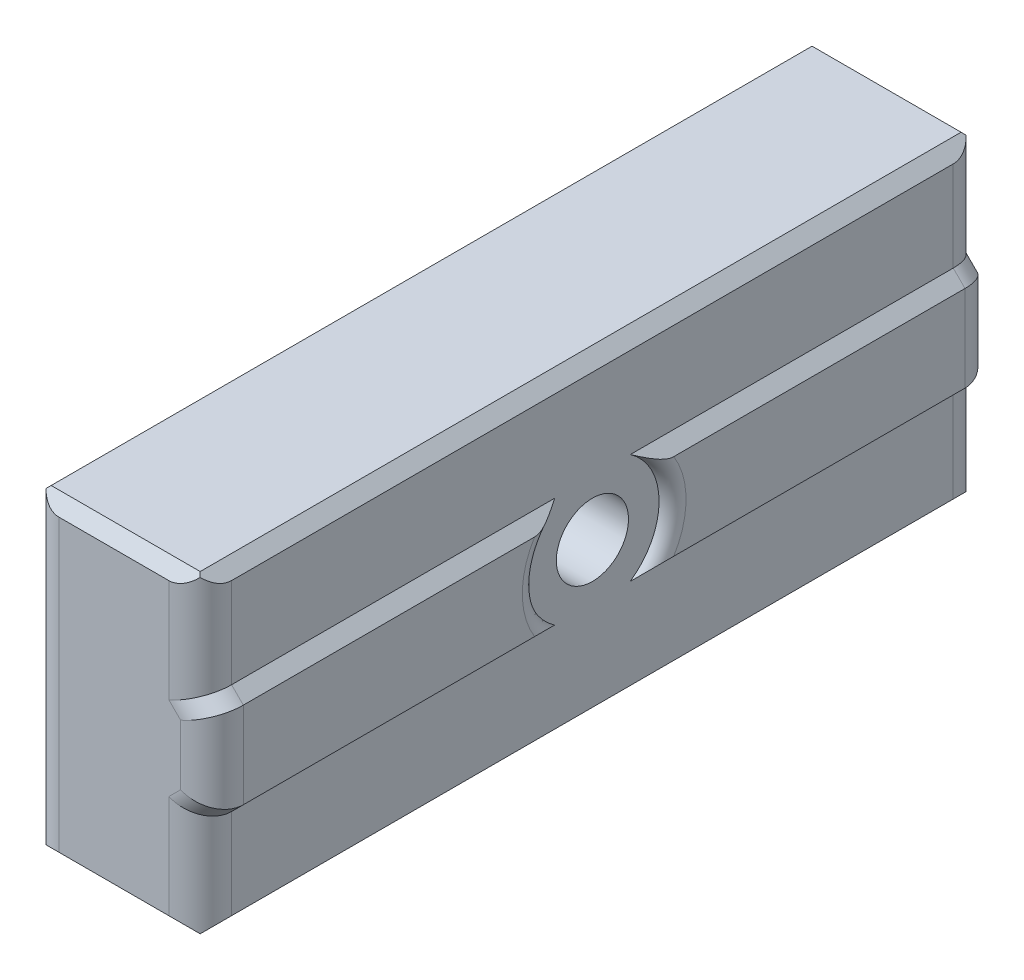
from build123d import *

# Parameters (mm, degrees)
SKIZZE3_W                       = 11
SKIZZE3_H                       = 20
AUFSATZ_LINEAR_AUSTRAGEN1_DEPTH = 50
SKIZZE4_R                       = 2.375
SCHNITT_LINEAR_AUSTRAGEN1_DEPTH = 10
AUFSATZ_LINEAR_AUSTRAGEN2_DEPTH = 50
SKIZZE5_R                       = 2.3
SCHNITT_LINEAR_AUSTRAGEN2_DEPTH = 56.11862208
SKIZZE6_R                       = 3.75
SCHNITT_LINEAR_AUSTRAGEN3_DEPTH = 4.5
SKIZZE8_R                       = 4.25
SCHNITT_LINEAR_AUSTRAGEN4_DEPTH = 6.5
VERRUNDUNG1_R                   = 1
FASE1_SIZE                      = 0.75
VERRUNDUNG2_R                   = 2


with BuildPart() as part:
    # Skizze3 → Aufsatz-Linear austragen1 (new body)
    with BuildSketch(Plane.XY):
        with Locations((5.5, -10)):
            Rectangle(SKIZZE3_W, SKIZZE3_H)
    extrude(amount=-AUFSATZ_LINEAR_AUSTRAGEN1_DEPTH)

    # Skizze4 → Schnitt-Linear austragen1 (cut)
    with BuildSketch(Plane.ZY):
        with Locations(Location((-40, -7, 0), (0, 0, 270))):
            Circle(SKIZZE4_R)
        with Locations(Location((-10, -7, 0), (0, 0, 270))):
            Circle(SKIZZE4_R)
    extrude(amount=-SCHNITT_LINEAR_AUSTRAGEN1_DEPTH, mode=Mode.SUBTRACT)

    # Skizze7 → Aufsatz-Linear austragen2 (add)
    with BuildSketch(Plane.XY):
        Polygon((11, -13.5), (11, -6.5), (11.75, -7.25), (11.75, -12.75), align=None)
    extrude(amount=-AUFSATZ_LINEAR_AUSTRAGEN2_DEPTH)

    # Skizze5 → Schnitt-Linear austragen2 (cut, through all)
    with BuildSketch(Plane.ZY):
        with Locations(Location((-25, -10, 0), (0, 0, 270))):
            Circle(SKIZZE5_R)
    extrude(amount=-SCHNITT_LINEAR_AUSTRAGEN2_DEPTH, mode=Mode.SUBTRACT)

    # Skizze6 → Schnitt-Linear austragen3 (cut)
    with BuildSketch(Plane.ZY):
        with Locations(Location((-25, -10, 0), (0, 0, 270))):
            Circle(SKIZZE6_R)
    extrude(amount=-SCHNITT_LINEAR_AUSTRAGEN3_DEPTH, mode=Mode.SUBTRACT)

    # Skizze8 → Schnitt-Linear austragen4 (cut)
    with BuildSketch(Plane(origin=(11, 0, 0), x_dir=(0, 0, -1), z_dir=(1, 0, 0))):
        with Locations((25, -10)):
            Circle(SKIZZE8_R)
    extrude(amount=SCHNITT_LINEAR_AUSTRAGEN4_DEPTH, mode=Mode.SUBTRACT)

    # Verrundung1
    # the kernel refuses this fillet: 1 mm, written as the material it takes off along each edge
    with BuildSketch(Plane(origin=(11.75, -10, -25), x_dir=(0, 0.9561204309063354, -0.29297392649088017), z_dir=(0, 0.29297392649088017, 0.9561204309063354))) as verrundung1_piece_1:
        with BuildLine():
            CenterArc((5.218245837, 1), VERRUNDUNG1_R, 194.477512186, 75.522487814)
            Line((5.218245837, 0), (5.218245837, -0.02))
            Line((5.218245837, -0.02), (4.25, -0.02))
            Line((4.25, -0.02), (4.23, 0))
            ThreePointArc((4.23, 0), (4.23, 0.375), (4.230635083, 0.745))
            Line((4.230635083, 0.745), (4.25, 0.75))
        make_face()
    revolve(axis=Axis((11.75, -10, -25), (-1, 0, 0)), revolution_arc=145.927830349, mode=Mode.SUBTRACT)
    with BuildSketch(Plane(origin=(11.75, -10, -25), x_dir=(0, -0.9561204309062743, 0.292973926491079), z_dir=(0, -0.292973926491079, -0.9561204309062743))) as verrundung1_piece_2:
        with BuildLine():
            CenterArc((5.218245837, 1), VERRUNDUNG1_R, 194.477512186, 75.522487814)
            Line((5.218245837, 0), (5.218245837, -0.02))
            Line((5.218245837, -0.02), (4.25, -0.02))
            Line((4.25, -0.02), (4.23, 0))
            ThreePointArc((4.23, 0), (4.23, 0.375), (4.230635083, 0.745))
            Line((4.230635083, 0.745), (4.25, 0.75))
        make_face()
    revolve(axis=Axis((11.75, -10, -25), (-1, 0, 0)), revolution_arc=145.927830349, mode=Mode.SUBTRACT)

    # Fase1
    fase1_edges = [part.edges().sort_by_distance(p)[0] for p in [
        (5.5, -20, -50),
        (5.5, -20, 0),
        (5.5, 0, 0),
        (11, -20, -25),
        (0, -20, -25),
        (0, 0, -25),
        (11, 0, -25),
        (5.5, 0, -50),
    ]]
    chamfer(fase1_edges, length=FASE1_SIZE)

    # Verrundung2
    verrundung2_edges = [part.edges().sort_by_distance(p)[0] for p in [
        (11, -3.625, 0),
        (11, -3.625, -50),
        (11.375, -6.875, 0),
        (11.375, -13.125, 0),
        (11.75, -10, 0),
        (11.375, -6.875, -50),
        (11.75, -10, -50),
        (11.375, -13.125, -50),
        (0, -10, 0),
        (0, -10, -50),
        (11, -16.375, -50),
        (11, -16.375, 0),
    ]]
    fillet(verrundung2_edges, radius=VERRUNDUNG2_R)


solid = part.part
